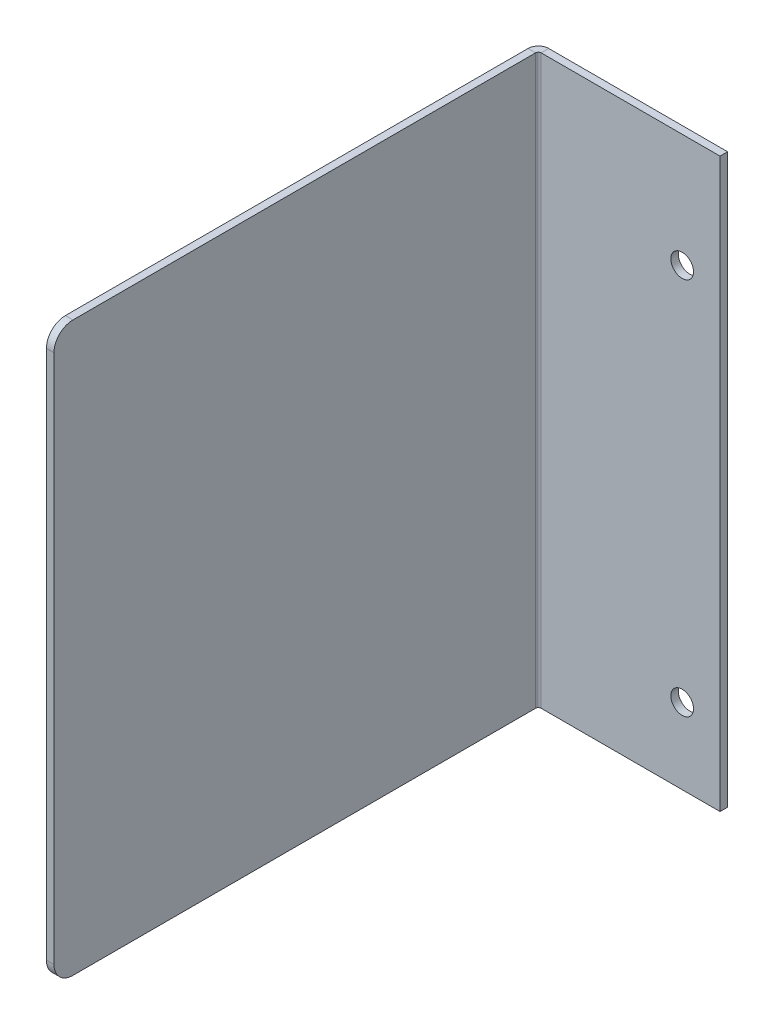
from build123d import *

# Parameters (mm, degrees)
SKETCH_1_W                       = 50
SKETCH_1_H                       = 150
SM_BASE_FLANGE_1_DEPTH           = 2
SM_EDGE_FLANGE_1_STRIP_W         = 9.4732
SM_EDGE_FLANGE_1_STRIP_H         = 2
SM_EDGE_FLANGE_1_STRIP_CUT_DEPTH = 150
SM_EDGE_FLANGE_1_DEPTH           = 150
SKETCH_8_R                       = 3
CUT_EXTRUDE_1_DEPTH              = 10
PATTERN_LINEAR_1_COUNT           = 2
PATTERN_LINEAR_1_PITCH           = 100
FILLET_2_R                       = 5
FILLET_3_R                       = 5


# Sheet-metal steps are written as plain solids
with BuildPart() as part:
    # Sketch 1 → 基体-法兰1 (new body)
    with BuildSketch(Plane.XY):
        with Locations((16.662404092, -67.250639386)):
            Rectangle(SKETCH_1_W, SKETCH_1_H)
    extrude(amount=-SM_BASE_FLANGE_1_DEPTH)

    # 边线-法兰1 strip (across the edge) → 边线-法兰1 strip cut (cut)
    with BuildSketch(Plane(origin=(-8.337595908, 7.749360614, 0), x_dir=(1, 0, 0), z_dir=(0, -1, 0))):
        with Locations((-2, -1)):
            Rectangle(SM_EDGE_FLANGE_1_STRIP_W, SM_EDGE_FLANGE_1_STRIP_H)
    extrude(amount=SM_EDGE_FLANGE_1_STRIP_CUT_DEPTH, mode=Mode.SUBTRACT)

    # 边线-法兰1 section (across the edge) → 边线-法兰1 (add)
    with BuildSketch(Plane(origin=(-8.337595908, 7.749360614, 0), x_dir=(1, 0, 0), z_dir=(0, -1, 0))):
        with BuildLine():
            Line((0, 0.7366), (0, 128))
            Line((0, 128), (2, 128))
            Line((2, 128), (2, 0.7366))
            ThreePointArc((2, 0.7366), (2.215745145, 0.215745145), (2.7366, 0))
            Line((2.7366, 0), (2.7366, -2))
            ThreePointArc((2.7366, -2), (0.801531583, -1.198468417), (0, 0.7366))
        make_face()
    extrude(amount=SM_EDGE_FLANGE_1_DEPTH)

    # 草图8 → 切除-拉伸1 (cut)
    with BuildSketch(Plane.XY):
        with Locations((31.662404092, -22.250639386)):
            Circle(SKETCH_8_R)
    cut_extrude_1 = extrude(amount=-CUT_EXTRUDE_1_DEPTH, mode=Mode.SUBTRACT)

    # 阵列(线性)1: 切除-拉伸1 ×2
    with Locations(*[(0, -i * PATTERN_LINEAR_1_PITCH, 0) for i in range(1, PATTERN_LINEAR_1_COUNT)]):
        add(cut_extrude_1, mode=Mode.SUBTRACT)

    # 圆角2
    fillet_2_edges = [part.edges().sort_by_distance(p)[0] for p in [
        (-7.337595908, 7.749360614, 128),
    ]]
    fillet(fillet_2_edges, radius=FILLET_2_R)

    # 圆角3
    fillet_3_edges = [part.edges().sort_by_distance(p)[0] for p in [
        (-7.337595908, -142.250639386, 128),
    ]]
    fillet(fillet_3_edges, radius=FILLET_3_R)


solid = part.part
